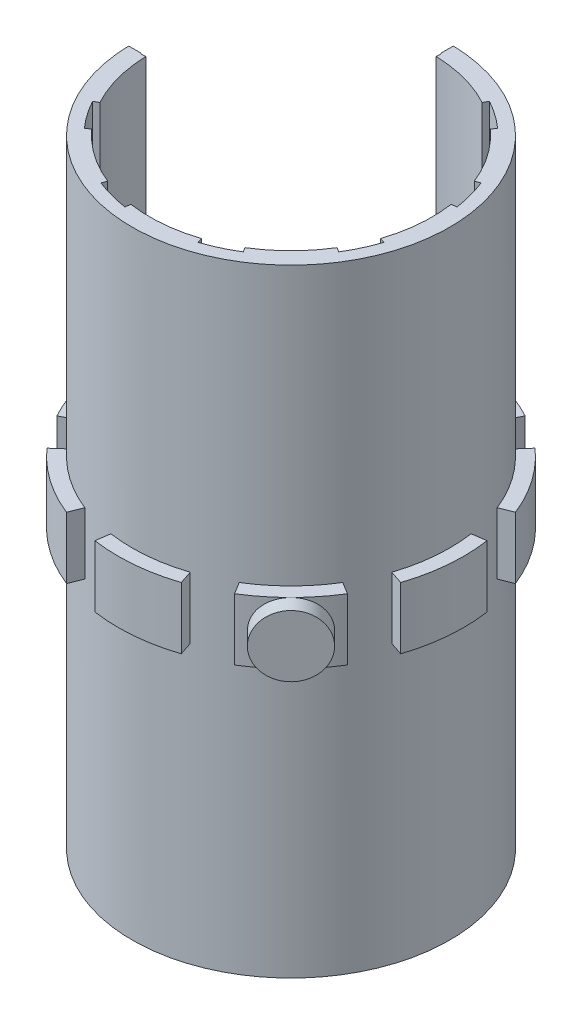
from build123d import *
from build123d.topology import SkipClean

# Parameters (mm, degrees)
CUT_EXTRUDE1_START     = -19.25
CUT_EXTRUDE1_OUTLINE_R = 9
CUT_EXTRUDE1_DEPTH     = 19.25
CUT_EXTRUDE1_2_DEPTH   = 3.5
BOSS_EXTRUDE1_START    = 15.75
SKETCH2_R              = 9
BOSS_EXTRUDE1_DEPTH    = 15.75
CUT_EXTRUDE2_DEPTH     = 61.653315082
CUT_EXTRUDE3_DEPTH     = 61.653315082
CUT_EXTRUDE4_DEPTH     = 61.653315082
CUT_EXTRUDE5_DEPTH     = 35
CUT_EXTRUDE6_DEPTH     = 35
CUT_EXTRUDE7_DEPTH     = 35
CUT_EXTRUDE8_DEPTH     = 35
CUT_EXTRUDE9_DEPTH     = 35
CUT_EXTRUDE10_DEPTH    = 61.653315082
CUT_EXTRUDE11_DEPTH    = 61.653315082


with BuildPart() as part:
    # Cut-Extrude1: read off the stored shape, not the designer's step
    # Cut-Extrude1 outline → Cut-Extrude1 (new body)
    with BuildSketch(Plane(origin=(0, 99.499, 0), x_dir=(-1, 0, 0), z_dir=(0, 1, 0)).offset(CUT_EXTRUDE1_START)):
        with Locations((-29, -21)):
            Circle(CUT_EXTRUDE1_OUTLINE_R)
    extrude(amount=CUT_EXTRUDE1_DEPTH)

    # Cut-Extrude1 2 outline → Cut-Extrude1 2 (add)
    with BuildSketch(Plane(origin=(0, 99.499, 0), x_dir=(-1, 0, 0), z_dir=(0, 1, 0)).offset(CUT_EXTRUDE1_START)):
        with BuildLine():
            ThreePointArc((-21.078187479, -16.728596672), (-20.306667563, -18.670628594), (-20.003807449, -20.738237531))
            Line((-20.003807449, -20.738237531), (-19.204145889, -20.714969756))
            ThreePointArc((-19.204145889, -20.714969756), (-19.533926902, -18.463573358), (-20.374026366, -16.348916376))
            Line((-20.374026366, -16.348916376), (-21.078187479, -16.728596672))
        make_face()
        with BuildLine():
            Line((-29.285030244, -30.795854111), (-29.261762469, -29.996192551))
            ThreePointArc((-29.261762469, -29.996192551), (-31.329371406, -29.693332437), (-33.271403328, -28.921812521))
            Line((-33.271403328, -28.921812521), (-33.651083624, -29.625973634))
            ThreePointArc((-33.651083624, -29.625973634), (-31.536426642, -30.466073098), (-29.285030244, -30.795854111))
        make_face()
        with BuildLine():
            ThreePointArc((-25.677144674, -12.635872282), (-23.837812073, -13.627631601), (-22.276774359, -15.016837209))
            Line((-22.276774359, -15.016837209), (-21.679154302, -14.485000517))
            ThreePointArc((-21.679154302, -14.485000517), (-23.378950924, -12.972309966), (-25.381779756, -11.892394263))
            Line((-25.381779756, -11.892394263), (-25.677144674, -12.635872282))
        make_face()
        with BuildLine():
            Line((-35.514999483, -28.320845698), (-34.983162791, -27.723225641))
            ThreePointArc((-34.983162791, -27.723225641), (-36.372368399, -26.162187927), (-37.364127718, -24.322855326))
            Line((-37.364127718, -24.322855326), (-38.107605737, -24.618220244))
            ThreePointArc((-38.107605737, -24.618220244), (-37.027690034, -26.621049076), (-35.514999483, -28.320845698))
        make_face()
        with BuildLine():
            ThreePointArc((-31.830902805, -12.456816208), (-29.784401684, -12.034247717), (-27.695613266, -12.095025253))
            Line((-27.695613266, -12.095025253), (-27.579667779, -11.303471942))
            ThreePointArc((-27.579667779, -11.303471942), (-29.854126279, -11.237291959), (-32.08253861, -11.697422093))
            Line((-32.08253861, -11.697422093), (-31.830902805, -12.456816208))
        make_face()
        with BuildLine():
            Line((-38.696528058, -22.420332221), (-37.904974747, -22.304386734))
            ThreePointArc((-37.904974747, -22.304386734), (-37.965752283, -20.215598316), (-37.543183792, -18.169097195))
            Line((-37.543183792, -18.169097195), (-38.302577907, -17.91746139))
            ThreePointArc((-38.302577907, -17.91746139), (-38.762708041, -20.145873721), (-38.696528058, -22.420332221))
        make_face()
        with BuildLine():
            ThreePointArc((-36.660050052, -16.275210777), (-35.363961031, -14.636038969), (-33.724789223, -13.339949948))
            Line((-33.724789223, -13.339949948), (-34.144770487, -12.65905661))
            ThreePointArc((-34.144770487, -12.65905661), (-35.929646456, -14.070353544), (-37.34094339, -15.855229513))
            Line((-37.34094339, -15.855229513), (-36.660050052, -16.275210777))
        make_face()
    extrude(amount=CUT_EXTRUDE1_2_DEPTH)

    # Sketch2 → Boss-Extrude1 (add)
    with SkipClean():  # the faces are left unmerged after this step: merging them gives an invalid solid
        with BuildSketch(Plane.XZ.offset(-80.249).offset(BOSS_EXTRUDE1_START)):
            with Locations(Location((29, -21, 0), (0, 0, 90))):
                Circle(SKETCH2_R)
        extrude(amount=-BOSS_EXTRUDE1_DEPTH)

    # Sketch3 → Cut-Extrude2 (cut, through all)
    with SkipClean():  # the faces are left unmerged after this step: merging them gives an invalid solid
        with BuildSketch(Plane.XZ.offset(-64.499)):
            with BuildLine():
                Line((29.205067383, -29.997663439), (29.205067383, -20.794932617))
                Line((29.205067383, -20.794932617), (20.002336561, -20.794932617))
                ThreePointArc((20.002336561, -20.794932617), (22.636038969, -27.363961031), (29.205067383, -29.997663439))
            make_face()
        extrude(amount=-CUT_EXTRUDE2_DEPTH, mode=Mode.SUBTRACT)

    # Sketch4 → Cut-Extrude3 (cut, through all)
    with SkipClean():  # the faces are left unmerged after this step: merging them gives an invalid solid
        with BuildSketch(Plane.XZ.offset(-64.499)):
            with BuildLine():
                Line((29.205067383, -20.794932617), (29.205067383, -28.997371279))
                ThreePointArc((29.205067383, -28.997371279), (34.656854249, -15.343145751), (21.002628721, -20.794932617))
                Line((21.002628721, -20.794932617), (29.205067383, -20.794932617))
            make_face()
        extrude(amount=-CUT_EXTRUDE3_DEPTH, mode=Mode.SUBTRACT)

    # Sketch5 → Cut-Extrude4 (cut, through all)
    with SkipClean():  # the faces are left unmerged after this step: merging them gives an invalid solid
        with BuildSketch(Plane.XZ.offset(-64.499)):
            with BuildLine():
                Line((32.796802958, -28.041611129), (32.939183069, -28.305671547))
                ThreePointArc((32.939183069, -28.305671547), (33.760684422, -27.798961968), (34.517805685, -27.200308091))
                Line((34.517805685, -27.200308091), (34.318366925, -26.97620057))
                ThreePointArc((34.318366925, -26.97620057), (33.588611491, -27.553216354), (32.796802958, -28.041611129))
            make_face()
        extrude(amount=-CUT_EXTRUDE4_DEPTH, mode=Mode.SUBTRACT)

    # Sketch6 → Cut-Extrude5 (cut)
    with SkipClean():  # the faces are left unmerged after this step: merging them gives an invalid solid
        with BuildSketch(Plane.XZ.offset(-64.499)):
            with BuildLine():
                Line((36.434780194, -23.953649179), (36.713584451, -24.064411023))
                ThreePointArc((36.713584451, -24.064411023), (37.017184358, -23.148198074), (37.2123656, -22.202934432))
                Line((37.2123656, -22.202934432), (36.915533109, -22.159454874))
                ThreePointArc((36.915533109, -22.159454874), (36.72740661, -23.070552361), (36.434780194, -23.953649179))
            make_face()
        extrude(amount=-CUT_EXTRUDE5_DEPTH, mode=Mode.SUBTRACT)

    # Sketch7 → Cut-Extrude6 (cut)
    with SkipClean():  # the faces are left unmerged after this step: merging them gives an invalid solid
        with BuildSketch(Plane.XZ.offset(-64.499)):
            with BuildLine():
                Line((36.593941149, -18.483641951), (36.878713942, -18.389278524))
                ThreePointArc((36.878713942, -18.389278524), (36.522354632, -17.492268428), (36.064268381, -16.642694383))
                Line((36.064268381, -16.642694383), (35.808933379, -16.800187357))
                ThreePointArc((35.808933379, -16.800187357), (36.250462296, -17.619053906), (36.593941149, -18.483641951))
            make_face()
        extrude(amount=-CUT_EXTRUDE6_DEPTH, mode=Mode.SUBTRACT)

    # Sketch8 → Cut-Extrude7 (cut)
    with SkipClean():  # the faces are left unmerged after this step: merging them gives an invalid solid
        with BuildSketch(Plane.XZ.offset(-64.499)):
            with BuildLine():
                Line((33.199812643, -14.191066621), (33.357305617, -13.935731619))
                ThreePointArc((33.357305617, -13.935731619), (32.507731572, -13.477645368), (31.610721476, -13.121286058))
                Line((31.610721476, -13.121286058), (31.516358049, -13.406058851))
                ThreePointArc((31.516358049, -13.406058851), (32.380946094, -13.749537704), (33.199812643, -14.191066621))
            make_face()
        extrude(amount=-CUT_EXTRUDE7_DEPTH, mode=Mode.SUBTRACT)

    # Sketch9 → Cut-Extrude8 (cut)
    with SkipClean():  # the faces are left unmerged after this step: merging them gives an invalid solid
        with BuildSketch(Plane.XZ.offset(-64.499)):
            with BuildLine():
                Line((27.840545126, -13.084466891), (27.797065568, -12.7876344))
                ThreePointArc((27.797065568, -12.7876344), (26.851801926, -12.982815642), (25.935588977, -13.286415549))
                Line((25.935588977, -13.286415549), (26.046350821, -13.565219806))
                ThreePointArc((26.046350821, -13.565219806), (26.929447639, -13.27259339), (27.840545126, -13.084466891))
            make_face()
        extrude(amount=-CUT_EXTRUDE8_DEPTH, mode=Mode.SUBTRACT)

    # Sketch10 → Cut-Extrude9 (cut)
    with SkipClean():  # the faces are left unmerged after this step: merging them gives an invalid solid
        with BuildSketch(Plane.XZ.offset(-64.499)):
            with BuildLine():
                Line((23.02379943, -15.681633075), (22.799691909, -15.482194315))
                ThreePointArc((22.799691909, -15.482194315), (22.201038032, -16.239315578), (21.694328453, -17.060816931))
                Line((21.694328453, -17.060816931), (21.958388871, -17.203197042))
                ThreePointArc((21.958388871, -17.203197042), (22.446783646, -16.411388509), (23.02379943, -15.681633075))
            make_face()
        extrude(amount=-CUT_EXTRUDE9_DEPTH, mode=Mode.SUBTRACT)

    # Sketch11 → Cut-Extrude10 (cut, through all)
    with SkipClean():  # the faces are left unmerged after this step: merging them gives an invalid solid
        with BuildSketch(Plane.XZ.offset(-64.499)):
            with BuildLine():
                Line((21.003384399, -20.76732225), (20.703511314, -20.758596834))
                ThreePointArc((20.703511314, -20.758596834), (20.703002605, -20.77676419), (20.702533678, -20.794932617))
                Line((20.702533678, -20.794932617), (21.002628721, -20.794932617))
                ThreePointArc((21.002628721, -20.794932617), (21.002994644, -20.781127107), (21.003384399, -20.76732225))
            make_face()
        extrude(amount=-CUT_EXTRUDE10_DEPTH, mode=Mode.SUBTRACT)

    # Sketch12 → Cut-Extrude11 (cut, through all)
    with SkipClean():  # the faces are left unmerged after this step: merging them gives an invalid solid
        with BuildSketch(Plane.XZ.offset(-64.499)):
            with BuildLine():
                Line((29.241403166, -29.296488686), (29.23267775, -28.996615601))
                ThreePointArc((29.23267775, -28.996615601), (29.218872893, -28.997005356), (29.205067383, -28.997371279))
                Line((29.205067383, -28.997371279), (29.205067383, -29.297466322))
                ThreePointArc((29.205067383, -29.297466322), (29.22323581, -29.296997395), (29.241403166, -29.296488686))
            make_face()
        extrude(amount=-CUT_EXTRUDE11_DEPTH, mode=Mode.SUBTRACT)

    # Sketch13 → Revolve1 (revolve)
    with SkipClean():  # the faces are left unmerged after this step: merging them gives an invalid solid
        with BuildSketch(Plane(origin=(0, 81.999, 0), x_dir=(1, 0, 0), z_dir=(0, 1, 0))):
            Polygon((35.818265909, 14.181734091), (34.580829041, 12.944297224), (35.328605692, 12.196520574), (36.566042559, 13.433957441), align=None)
        revolve(axis=Axis((36.566042559, 81.999, -13.433957441), (-0.7071067811865508, 0, -0.7071067811865442)))


solid = part.part
